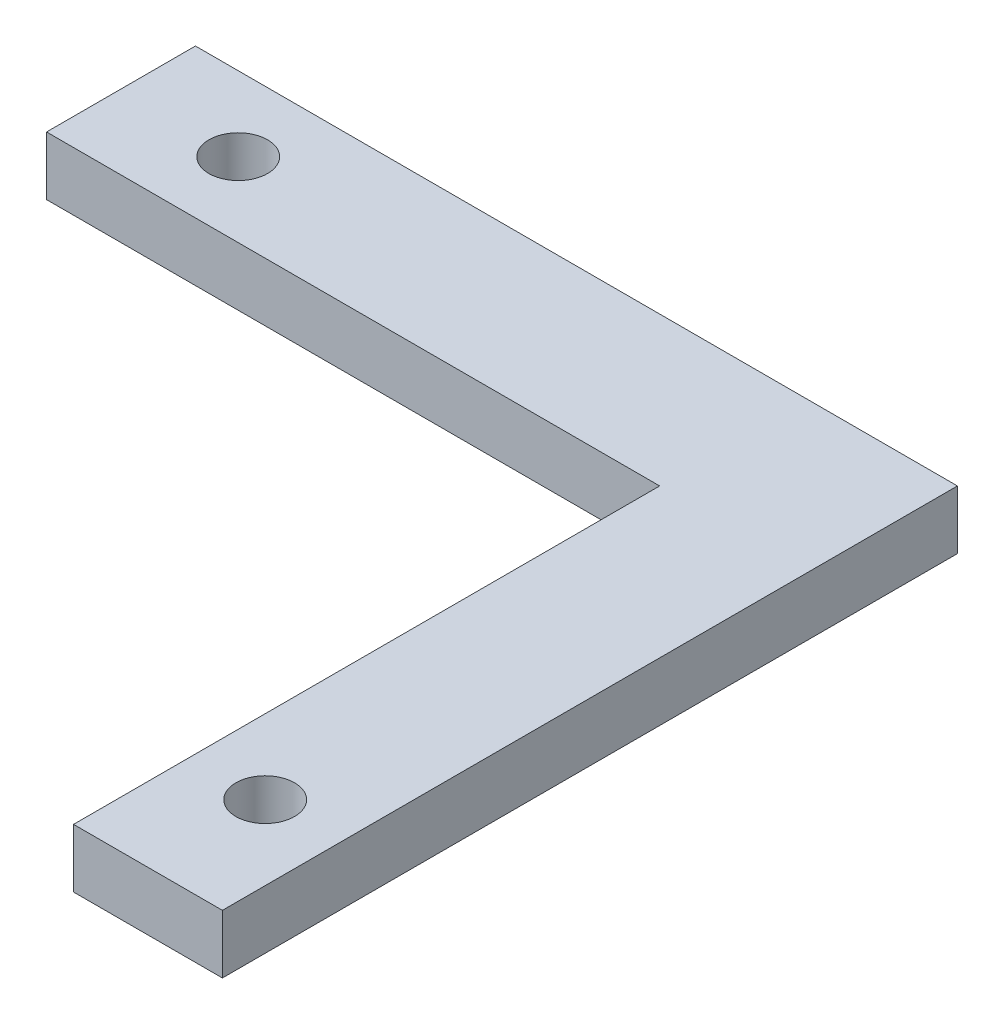
from build123d import *

# Parameters (mm, degrees)
BOSS_EXTRUDE1_DEPTH = 5


with BuildPart() as part:
    # Sketch1 → Boss-Extrude1 (new body)
    with BuildSketch(Plane(origin=(0, 0, 0), x_dir=(1, 0, 0), z_dir=(0, 1, 0))):
        Polygon((0, 12.7), (0, 6.35), (0, 0), (52.3, 0), (52.3, -50), (58.65, -50), (65, -50), (65, 0), (65, 12.7), align=None)
        with BuildLine():
            ThreePointArc((61.15, -40), (60.417766953, -41.767766953), (58.65, -42.5))
            ThreePointArc((58.65, -42.5), (56.882233047, -38.232233047), (61.15, -40))
        make_face(mode=Mode.SUBTRACT)
        with BuildLine():
            ThreePointArc((12.5, 6.35), (10, 3.85), (7.5, 6.35))
            ThreePointArc((7.5, 6.35), (10, 8.85), (12.5, 6.35))
        make_face(mode=Mode.SUBTRACT)
    extrude(amount=BOSS_EXTRUDE1_DEPTH)


solid = part.part
